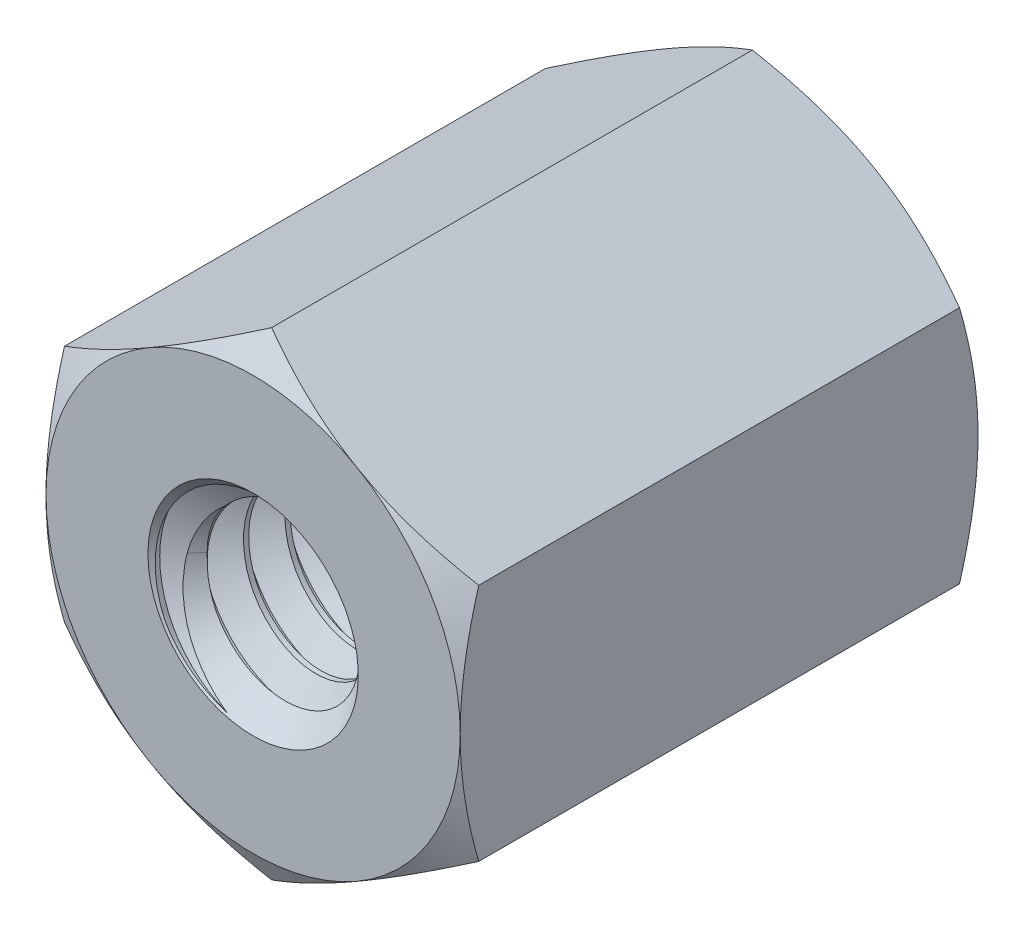
from build123d import *

# Parameters (mm, degrees)
EXTRUDE1_DEPTH          = 7.9375
EXTRUDE1_DEPTH_BACK     = 7.9375
SKETCH1_R               = 3.175
SWEEP1_PITCH            = 1.27
EXTRUDE2_DEPTH          = 20.698802089
SKETCH8_OUTSIDE_W       = 91.58
SKETCH8_OUTSIDE_H       = 93.544
SKETCH8_OUTSIDE_R       = 6.35
EXTRUDE4_DEPTH          = 20.698802089
EXTRUDE4_DRAFT          = -60
MIRROR1_COPY_1_SKETCH_W = 91.58
MIRROR1_COPY_1_SKETCH_H = 93.544
MIRROR1_COPY_1_SKETCH_R = 6.35
MIRROR1_COPY_1_DEPTH    = 20.698802089
MIRROR1_COPY_1_DRAFT    = -60


with BuildPart() as part:
    # Sketch1 → Extrude1 (new, two sides: drawn at the far end of the back side and taken through both)
    with BuildSketch(Plane.XY.offset(-EXTRUDE1_DEPTH_BACK)):
        Polygon((0, 7.332348419), (-6.35, 3.666174209), (-6.35, -3.666174209), (0, -7.332348419), (6.35, -3.666174209), (6.35, 3.666174209), align=None)
        Circle(SKETCH1_R, mode=Mode.SUBTRACT)
    extrude(amount=EXTRUDE1_DEPTH + EXTRUDE1_DEPTH_BACK)

    # Sweep1: the profile of Sketch12 profile screwed along a right-hand helix of 13.5 turns, 8 arcs to a turn; built about Z, then put on its axis
    sweep1_z = Axis((0, 0, 0), (0, 0, 1))
    sweep1_corners = [(3.1753, 0, -1.111423205), (3.1753, 0, 0.000173205), (2.350110803, 0, -0.47625), (2.350110803, 0, -0.635)]
    with BuildLine(mode=Mode.PRIVATE) as sweep1_profile:
        Line(sweep1_corners[0], sweep1_corners[1])
        Line(sweep1_corners[1], sweep1_corners[2])
        Line(sweep1_corners[2], sweep1_corners[3])
        Line(sweep1_corners[3], sweep1_corners[0])
    sweep1_cap = Face(sweep1_profile.wire())
    sweep1_turn_angles = [0, 22.5, 45, 67.5, 90, 112.5, 135, 157.5, 180, 202.5, 225, 247.5, 270, 292.5, 315, 337.5, 360]
    sweep1_turn_weights = [1, 0.9238795325112867, 1, 0.9238795325112867, 1, 0.9238795325112867, 1, 0.9238795325112867, 1, 0.9238795325112867, 1, 0.9238795325112867, 1, 0.9238795325112867, 1, 0.9238795325112867, 1]
    sweep1_turn_rails = [Edge.make_bspline([Vector(p[0], p[1], 0).rotate(sweep1_z, sweep1_turn_angles[k]) / sweep1_turn_weights[k] + Vector(0, 0, p[2] + SWEEP1_PITCH * sweep1_turn_angles[k] / 360) for k in range(17)], [0, 0, 0, 1, 1, 2, 2, 3, 3, 4, 4, 5, 5, 6, 6, 7, 7, 8, 8, 8], 2, sweep1_turn_weights) for p in sweep1_corners]
    sweep1_turn_sides = [Face.make_surface_from_curves(sweep1_turn_rails[p[0]], sweep1_turn_rails[p[1]]) for p in [(0, 1), (1, 2), (2, 3), (3, 0)]]
    sweep1_last_angles = [4680, 4702.5, 4725, 4747.5, 4770, 4792.5, 4815, 4837.5, 4860]
    sweep1_last_weights = [1, 0.9238795325112867, 1, 0.9238795325112867, 1, 0.9238795325112867, 1, 0.9238795325112351, 1]
    sweep1_last_rails = [Edge.make_bspline([Vector(p[0], p[1], 0).rotate(sweep1_z, sweep1_last_angles[k]) / sweep1_last_weights[k] + Vector(0, 0, p[2] + SWEEP1_PITCH * sweep1_last_angles[k] / 360) for k in range(9)], [0, 0, 0, 1, 1, 2, 2, 3, 3, 4, 4, 4], 2, sweep1_last_weights) for p in sweep1_corners]
    sweep1_last_sides = [Face.make_surface_from_curves(sweep1_last_rails[p[0]], sweep1_last_rails[p[1]]) for p in [(0, 1), (1, 2), (2, 3), (3, 0)]]
    sweep1 = Plane(origin=(0, 0, -7.9375), x_dir=(0, 1, 0), z_dir=(0, 0, 1)) * Solid(Shell([*[p.moved(Location((0, 0, SWEEP1_PITCH * i))) for i in range(13) for p in sweep1_turn_sides], *sweep1_last_sides, sweep1_cap, sweep1_cap.rotate(sweep1_z, 4860).moved(Location((0, 0, SWEEP1_PITCH * 4860 / 360)))]))
    add(sweep1)

    # Sketch6 → Extrude2 (cut, through all)
    with BuildSketch(Plane(origin=(0, 0, -7.9375), x_dir=(-1, 0, 0), z_dir=(0, 0, -1))):
        Polygon((0, 7.332348419), (-6.35, 3.666174209), (-6.35, -3.666174209), (0, -7.332348419), (6.35, -3.666174209), (6.35, 3.666174209), align=None)
    extrude2 = extrude(amount=EXTRUDE2_DEPTH, mode=Mode.SUBTRACT)

    # Extrude3 cone 1 section (through the dimple's axis) → Extrude3 (revolve, cut)
    with BuildSketch(Plane(origin=(0, 0, -7.9375), x_dir=(0, 1, 0), z_dir=(1, 0, 0))):
        Polygon((0, 0), (3.2258, 0), (0, 3.459246985), align=None)
    extrude3 = revolve(axis=Axis((0, 0, -7.9375), (0, 0, 1)), mode=Mode.SUBTRACT)


with BuildPart() as extrude4_tool:
    # Sketch8 outside → Extrude4 (with draft: the straight prism first)
    with BuildSketch(Plane(origin=(0, 0, -7.9375), x_dir=(-1, 0, 0), z_dir=(0, 0, -1))):
        Rectangle(SKETCH8_OUTSIDE_W, SKETCH8_OUTSIDE_H)
        Circle(SKETCH8_OUTSIDE_R, mode=Mode.SUBTRACT)
    extrude(amount=-EXTRUDE4_DEPTH)
    # Extrude4: the draft: its side faces are tilted about the plane it starts from
    extrude4_sides = [extrude4_tool.faces().sort_by_distance(p)[0] for p in [
        (0, -46.772, 2.411901044),
        (-45.79, 0, 2.411901044),
        (0, 46.772, 2.411901044),
        (45.79, 0, 2.411901044),
        (6.35, 0, 2.411901044),
    ]]
    draft(extrude4_sides, Plane(origin=(0, 0, -7.9375), x_dir=(-1, 0, 0), z_dir=(0, 0, -1)), EXTRUDE4_DRAFT)


with BuildPart() as part_1:
    add(part.part)

    # Extrude4: cut by extrude4_tool
    add(extrude4_tool.part, mode=Mode.SUBTRACT)

    # Mirror1: Extrude2, Extrude3 across plane
    add(extrude2.mirror(Plane.XY), mode=Mode.SUBTRACT)
    add(extrude3.mirror(Plane.XY), mode=Mode.SUBTRACT)


with BuildPart() as mirror1_copy_1_tool:
    # Mirror1 copy 1 sketch → Mirror1 copy 1 (with draft: the straight prism first)
    with BuildSketch(Plane(origin=(0, 0, 7.9375), x_dir=(-1, 0, 0), z_dir=(0, 0, 1))):
        Rectangle(MIRROR1_COPY_1_SKETCH_W, MIRROR1_COPY_1_SKETCH_H)
        Circle(MIRROR1_COPY_1_SKETCH_R, mode=Mode.SUBTRACT)
    extrude(amount=-MIRROR1_COPY_1_DEPTH)
    # Mirror1 copy 1: the draft: its side faces are tilted about the plane it starts from
    mirror1_copy_1_sides = [mirror1_copy_1_tool.faces().sort_by_distance(p)[0] for p in [
        (0, -46.772, -2.411901044),
        (-45.79, 0, -2.411901044),
        (0, 46.772, -2.411901044),
        (45.79, 0, -2.411901044),
        (6.35, 0, -2.411901044),
    ]]
    draft(mirror1_copy_1_sides, Plane(origin=(0, 0, 7.9375), x_dir=(-1, 0, 0), z_dir=(0, 0, 1)), MIRROR1_COPY_1_DRAFT)


with BuildPart() as part_2:
    add(part_1.part)

    # Mirror1 copy 1: cut by mirror1_copy_1_tool
    add(mirror1_copy_1_tool.part, mode=Mode.SUBTRACT)


solid = part_2.part
